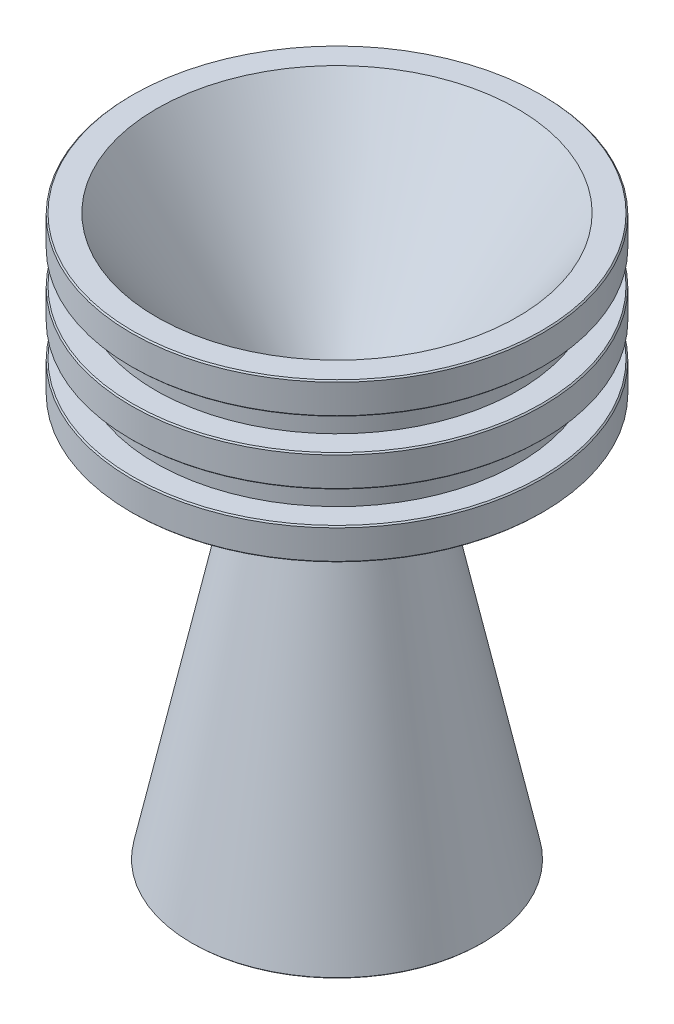
from build123d import *
from OCP.BRepFilletAPI import BRepFilletAPI_MakeChamfer

# Parameters (mm, degrees)
OUTER_CHAMFERS_SIZE  = 0.127
OUTER_CHAMFERS_SIZE2 = 0.107077278


with BuildPart() as part:
    # Sketch1 → base_revolve (revolve)
    with BuildSketch(Plane.XY):
        Polygon((0, 0), (2.54, 0), (16.51, -19.951227654), (16.51, -22.491227654), (9.294220745, -56.4388), (6.048289356, -56.4388), (13.264068611, -22.491227654), (13.264068611, -20.851000787), (9.77983535, -15.875), (0, -15.875), (0, -12.7), (2.44475, -12.7), (2.44475, -9.525), (0, -9.525), (0, -6.35), (2.44475, -6.35), (2.44475, -3.175), (0, -3.175), align=None)
    revolve(axis=Axis((20.701, 0, 0), (0, -1, 0)))

    # outer_chamfers: one chamfer whose edges measure the first distance from different faces: ONE call of the kernel's chamfer builder (chamfer() names one face for all edges)
    outer_chamfers_edges_1 = [part.edges().sort_by_distance(p)[0] for p in [
        (41.402, -15.875, 0),
        (41.402, 0, 0),
        (41.402, -9.525, 0),
        (41.402, -12.7, 0),
        (41.402, -6.35, 0),
        (41.402, -3.175, 0),
    ]]
    outer_chamfers_edges_2 = [part.edges().sort_by_distance(p)[0] for p in [
        (35.353710644, -56.4388, 0),
    ]]
    outer_chamfers_side_2 = [part.faces().sort_by_distance(p)[0] for p in [
        (32.522220497, -56.4388, 0),
    ]]
    outer_chamfers = BRepFilletAPI_MakeChamfer(part.part.solid().wrapped)
    for e in outer_chamfers_edges_1:
        outer_chamfers.Add(OUTER_CHAMFERS_SIZE, e.wrapped)
    for e in outer_chamfers_edges_2:
        outer_chamfers.Add(OUTER_CHAMFERS_SIZE, OUTER_CHAMFERS_SIZE2, e.wrapped, outer_chamfers_side_2[0].wrapped)  # the first distance lies on this face
    add(Compound.cast(outer_chamfers.Shape()), mode=Mode.REPLACE)


solid = part.part
